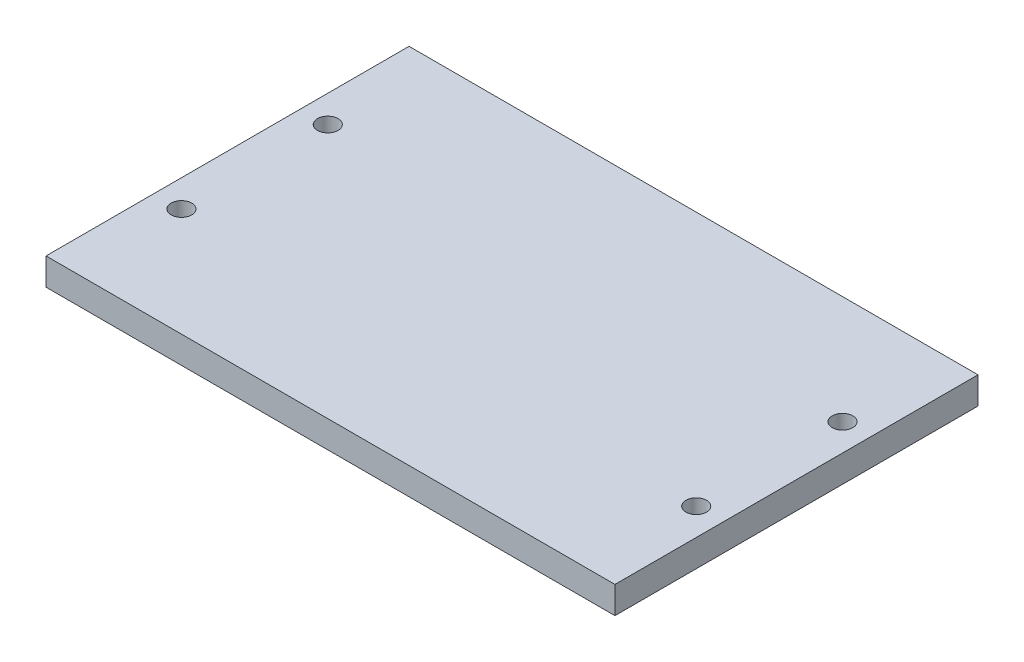
from build123d import *

# Parameters (mm, degrees)
SKETCH1_W           = 133.35
SKETCH1_H           = 85.09
BOSS_EXTRUDE1_DEPTH = 6.35
SKETCH2_R           = 2.413
CUT_EXTRUDE1_DEPTH  = 101.417876049


with BuildPart() as part:
    # Sketch1 → Boss-Extrude1 (new body)
    with BuildSketch(Plane(origin=(0, 0, 0), x_dir=(1, 0, 0), z_dir=(0, 1, 0))):
        with Locations((21.486627907, 5.109534884)):
            Rectangle(SKETCH1_W, SKETCH1_H)
    extrude(amount=BOSS_EXTRUDE1_DEPTH)

    # Sketch2 → Cut-Extrude1 (cut, through all)
    with BuildSketch(Plane(origin=(0, 6.35, 0), x_dir=(1, 0, 0), z_dir=(0, 1, 0))):
        with Locations((81.811627907, -12.035465116)):
            Circle(SKETCH2_R)
        with Locations((81.811627907, 22.254534884)):
            Circle(SKETCH2_R)
        with Locations((-38.838372093, 22.254534884)):
            Circle(SKETCH2_R)
        with Locations((-38.838372093, -12.035465116)):
            Circle(SKETCH2_R)
    extrude(amount=-CUT_EXTRUDE1_DEPTH, mode=Mode.SUBTRACT)


solid = part.part
